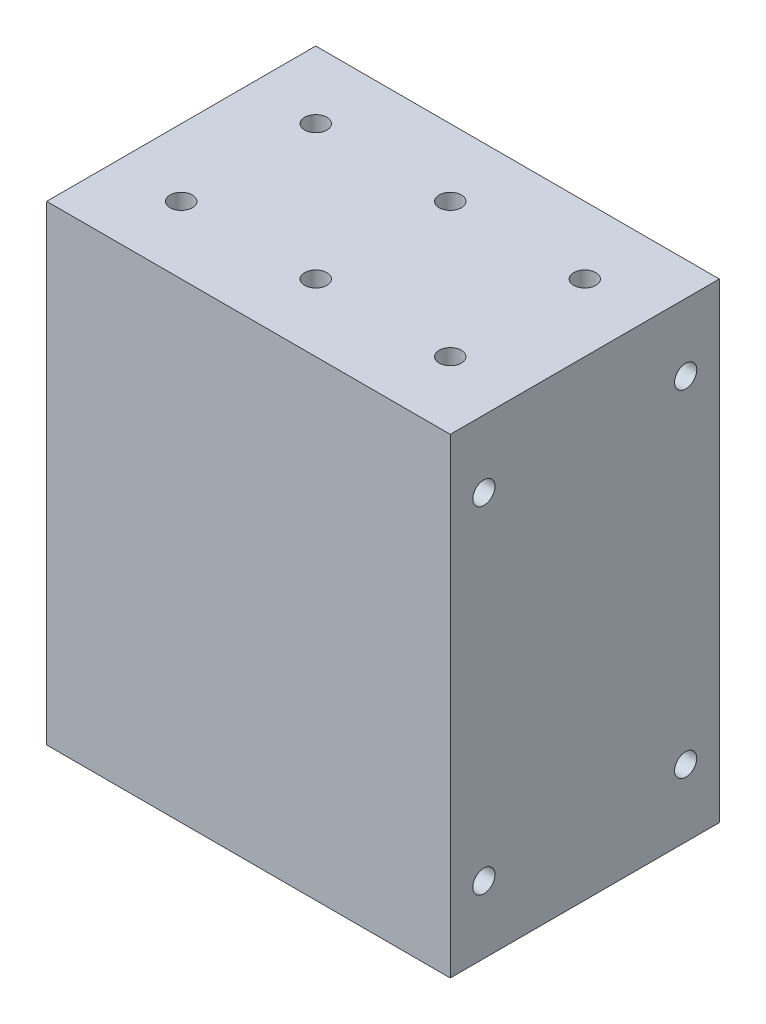
from build123d import *

# Parameters (mm, degrees)
SKETCH1_W                      = 60
SKETCH1_H                      = 40
BOSS_EXTRUDE1_DEPTH            = 70
M4X0_7_TAPPED_HOLE1_D          = 3.3
M4X0_7_TAPPED_HOLE1_DEPTH      = 15
M4X0_7_TAPPED_HOLE1_TIP        = 0.991420021
M4X0_7_TAPPED_HOLE2_D          = 3.3
M4X0_7_TAPPED_HOLE2_DEPTH      = 15
M4X0_7_TAPPED_HOLE2_TIP        = 0.991420021
M4X0_7_TAPPED_HOLE3_D          = 3.3
M4X0_7_TAPPED_HOLE3_DEPTH      = 15
M4X0_7_TAPPED_HOLE3_TIP        = 0.991420021
M4X0_7_TAPPED_HOLE4_AT_2_COUNT = 2
M4X0_7_TAPPED_HOLE4_AT_2_PITCH = 30
M4X0_7_TAPPED_HOLE4_AT_3_COUNT = 2
M4X0_7_TAPPED_HOLE4_AT_3_PITCH = 58.309518948
M4X0_7_TAPPED_HOLE4_AT_4_COUNT = 2
M4X0_7_TAPPED_HOLE4_AT_4_PITCH = 50


with BuildPart() as part:
    # Sketch1 → Boss-Extrude1 (new body)
    with BuildSketch(Plane(origin=(0, 0, 0), x_dir=(1, 0, 0), z_dir=(0, 1, 0))):
        Rectangle(SKETCH1_W, SKETCH1_H)
    extrude(amount=BOSS_EXTRUDE1_DEPTH)

    # M4x0.7 Tapped Hole1
    with Locations(Plane(origin=(0, 70, 0), x_dir=(1, 0, 0), z_dir=(0, 1, 0))):
        with Locations((-20, 10), (0, 10), (20, 10), (0, -10), (20, -10), (-20, -10)):
            Hole(M4X0_7_TAPPED_HOLE1_D / 2, depth=M4X0_7_TAPPED_HOLE1_DEPTH)
            with Locations((0, 0, -(M4X0_7_TAPPED_HOLE1_DEPTH + M4X0_7_TAPPED_HOLE1_TIP / 2))):  # 118° drill point
                Cone(0, M4X0_7_TAPPED_HOLE1_D / 2, M4X0_7_TAPPED_HOLE1_TIP, mode=Mode.SUBTRACT)

    # M4x0.7 Tapped Hole2
    with Locations(Plane(origin=(0, 0, 0), x_dir=(-1, 0, 0), z_dir=(0, -1, 0))):
        with Locations((-20, 10), (0, 10), (20, 10), (0, -10), (20, -10), (-20, -10)):
            Hole(M4X0_7_TAPPED_HOLE2_D / 2, depth=M4X0_7_TAPPED_HOLE2_DEPTH)
            with Locations((0, 0, -(M4X0_7_TAPPED_HOLE2_DEPTH + M4X0_7_TAPPED_HOLE2_TIP / 2))):  # 118° drill point
                Cone(0, M4X0_7_TAPPED_HOLE2_D / 2, M4X0_7_TAPPED_HOLE2_TIP, mode=Mode.SUBTRACT)

    # M4x0.7 Tapped Hole3
    with Locations(Plane(origin=(0, 0, -20), x_dir=(-1, 0, 0), z_dir=(0, 0, -1))):
        with Locations((-15, 55), (15, 55), (15, 15), (-15, 15)):
            Hole(M4X0_7_TAPPED_HOLE3_D / 2, depth=M4X0_7_TAPPED_HOLE3_DEPTH)
            with Locations((0, 0, -(M4X0_7_TAPPED_HOLE3_DEPTH + M4X0_7_TAPPED_HOLE3_TIP / 2))):  # 118° drill point
                Cone(0, M4X0_7_TAPPED_HOLE3_D / 2, M4X0_7_TAPPED_HOLE3_TIP, mode=Mode.SUBTRACT)

    # Sketch10 → M4x0.7 Tapped Hole4 (revolve, cut)
    with BuildSketch(Plane(origin=(30, 60, 15), x_dir=(0, 0, -1), z_dir=(0, 1, 0))):
        Polygon((0, 0), (0, 15.991420021), (1.65, 15), (1.65, 0), align=None)
    m4x0_7_tapped_hole4 = revolve(axis=Axis((36.35, 60, 15), (-1, 0, 0)), mode=Mode.SUBTRACT)

    # M4x0.7 Tapped Hole4 at 2: M4x0.7 Tapped Hole4 ×2
    with Locations(*[(0, 0, -i * M4X0_7_TAPPED_HOLE4_AT_2_PITCH) for i in range(1, M4X0_7_TAPPED_HOLE4_AT_2_COUNT)]):
        add(m4x0_7_tapped_hole4, mode=Mode.SUBTRACT)

    # M4x0.7 Tapped Hole4 at 3: M4x0.7 Tapped Hole4 ×2
    with Locations(*[Vector(0, -0.8574929257125403, -0.5144957554275331) * (i * M4X0_7_TAPPED_HOLE4_AT_3_PITCH) for i in range(1, M4X0_7_TAPPED_HOLE4_AT_3_COUNT)]):
        add(m4x0_7_tapped_hole4, mode=Mode.SUBTRACT)

    # M4x0.7 Tapped Hole4 at 4: M4x0.7 Tapped Hole4 ×2
    with Locations(*[(0, -i * M4X0_7_TAPPED_HOLE4_AT_4_PITCH, 0) for i in range(1, M4X0_7_TAPPED_HOLE4_AT_4_COUNT)]):
        add(m4x0_7_tapped_hole4, mode=Mode.SUBTRACT)

    # Mirror1: M4x0.7 Tapped Hole4 across plane
    add(m4x0_7_tapped_hole4.mirror(Plane(origin=(0, 0, 0), x_dir=(0, 0, 1), z_dir=(1, 0, 0))), mode=Mode.SUBTRACT)

    # Mirror1 copy 1 sketch → Mirror1 copy 1 (revolve, cut)
    with BuildSketch(Plane(origin=(-30, 60, -15), x_dir=(0, 0, -1), z_dir=(0, 1, 0))):
        Polygon((0, 0), (0, -15.991420021), (1.65, -15), (1.65, 0), align=None)
    revolve(axis=Axis((-36.35, 60, -15), (-1, 0, 0)), mode=Mode.SUBTRACT)

    # Mirror1 copy 2 sketch → Mirror1 copy 2 (revolve, cut)
    with BuildSketch(Plane(origin=(-30, 10, -15), x_dir=(0, 0, -1), z_dir=(0, 1, 0))):
        Polygon((0, 0), (0, -15.991420021), (1.65, -15), (1.65, 0), align=None)
    revolve(axis=Axis((-36.35, 10, -15), (-1, 0, 0)), mode=Mode.SUBTRACT)

    # Mirror1 copy 3 sketch → Mirror1 copy 3 (revolve, cut)
    with BuildSketch(Plane(origin=(-30, 10, 15), x_dir=(0, 0, -1), z_dir=(0, 1, 0))):
        Polygon((0, 0), (0, -15.991420021), (1.65, -15), (1.65, 0), align=None)
    revolve(axis=Axis((-36.35, 10, 15), (-1, 0, 0)), mode=Mode.SUBTRACT)


solid = part.part
